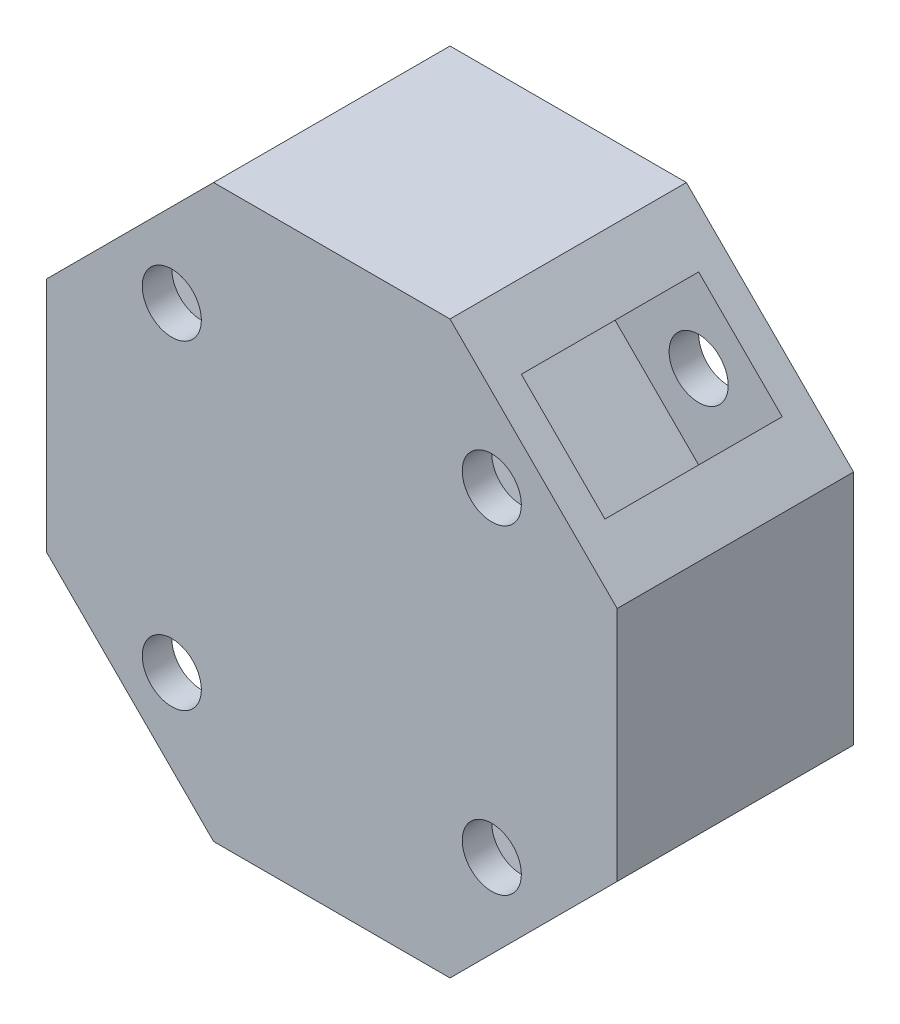
from build123d import *

# Parameters (mm, degrees)
BOSS_EXTRUDE1_DEPTH     = 25.4
SKETCH2_W               = 19.05
SKETCH2_H               = 12.7
CUT_EXTRUDE1_DEPTH      = 12.7
MIRROR2_COPY_1_SKETCH_W = 19.05
MIRROR2_COPY_1_SKETCH_H = 12.7
MIRROR2_COPY_1_DEPTH    = 12.7
MIRROR2_COPY_2_SKETCH_W = 19.05
MIRROR2_COPY_2_SKETCH_H = 12.7
MIRROR2_COPY_2_DEPTH    = 12.7
SKETCH3_R               = 3.175
CUT_EXTRUDE2_DEPTH      = 51.252303648


with BuildPart() as part:
    # Sketch1 → Boss-Extrude1 (new body)
    with BuildSketch(Plane.XY):
        Polygon((-30.660512242, 12.7), (-30.660512242, -12.7), (-12.7, -30.660512242), (12.7, -30.660512242), (30.660512242, -12.7), (30.660512242, 12.7), (12.7, 30.660512242), (-12.7, 30.660512242), align=None)
    extrude(amount=BOSS_EXTRUDE1_DEPTH)

    # Sketch2 → Cut-Extrude1 (cut)
    with BuildSketch(Plane(origin=(21.680256121, 21.680256121, 0), x_dir=(0, 0, -1), z_dir=(0.7071067811865479, 0.7071067811865472, 0))):
        with Locations((-12.7, 0)):
            Rectangle(SKETCH2_W, SKETCH2_H)
    cut_extrude1 = extrude(amount=-CUT_EXTRUDE1_DEPTH, mode=Mode.SUBTRACT)

    # Mirror1: Cut-Extrude1 across plane
    add(cut_extrude1.mirror(Plane(origin=(0, 0, 0), x_dir=(0, 0, 1), z_dir=(1, 0, 0))), mode=Mode.SUBTRACT)

    # Mirror2 copy 1 sketch → Mirror2 copy 1 (cut)
    with BuildSketch(Plane(origin=(-21.680256121, -21.680256121, 0), x_dir=(0, 0, -1), z_dir=(-0.7071067811865472, -0.7071067811865479, 0))):
        with Locations((-12.7, 0)):
            Rectangle(MIRROR2_COPY_1_SKETCH_W, MIRROR2_COPY_1_SKETCH_H)
    extrude(amount=-MIRROR2_COPY_1_DEPTH, mode=Mode.SUBTRACT)

    # Mirror2 copy 2 sketch → Mirror2 copy 2 (cut)
    with BuildSketch(Plane(origin=(21.680256121, -21.680256121, 0), x_dir=(0, 0, -1), z_dir=(0.7071067811865479, -0.7071067811865472, 0))):
        with Locations((-12.7, 0)):
            Rectangle(MIRROR2_COPY_2_SKETCH_W, MIRROR2_COPY_2_SKETCH_H)
    extrude(amount=-MIRROR2_COPY_2_DEPTH, mode=Mode.SUBTRACT)

    # Sketch3 → Cut-Extrude2 (cut, through all)
    with BuildSketch(Plane.XY.offset(25.4)):
        with Locations((-17.190128061, 17.190128061)):
            Circle(SKETCH3_R)
        with Locations((-17.190128061, -17.190128061)):
            Circle(SKETCH3_R)
        with Locations((17.190128061, -17.190128061)):
            Circle(SKETCH3_R)
        with Locations((17.190128061, 17.190128061)):
            Circle(SKETCH3_R)
    extrude(amount=-CUT_EXTRUDE2_DEPTH, mode=Mode.SUBTRACT)


solid = part.part
